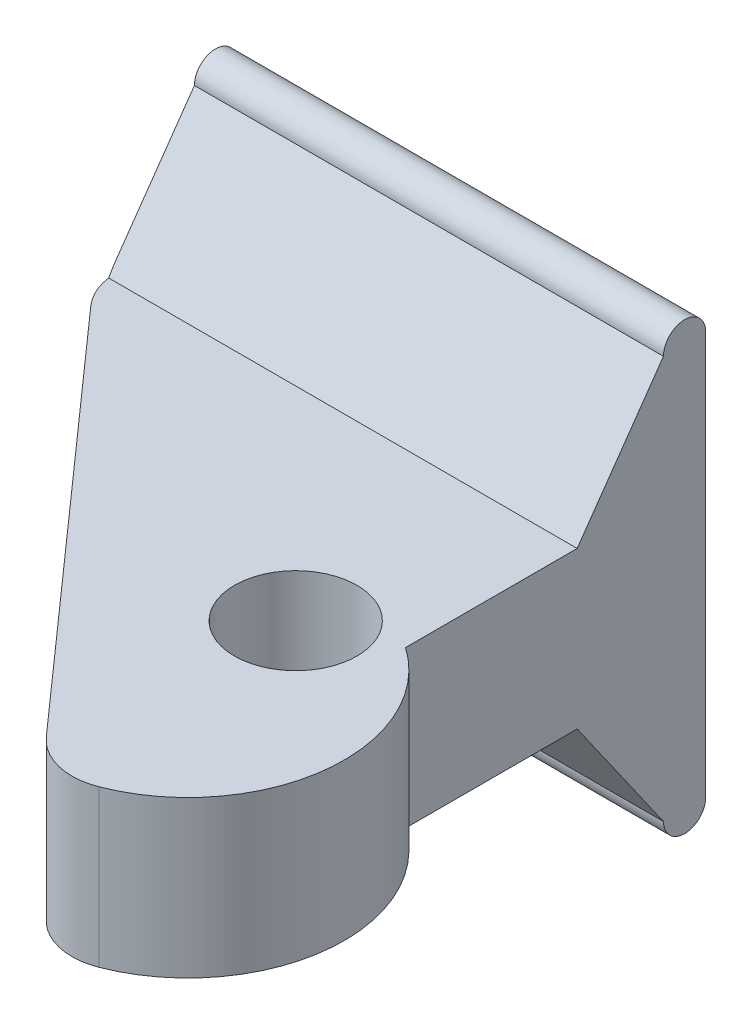
from build123d import *

# Parameters (mm, degrees)
SKETCH1_R               = 2.4892
BOSS_EXTRUDE1_DEPTH     = 6.35
BOSS_EXTRUDE2_START     = -6.35
BOSS_EXTRUDE2_DEPTH     = 19.05
BOSS_EXTRUDE2_START_2   = -6.555460136
BOSS_EXTRUDE2_2_DEPTH   = 19.460920272
BOSS_EXTRUDE2_START_3   = -10
BOSS_EXTRUDE2_3_DEPTH   = 3.65
CUT_EXTRUDE1_DEPTH      = 27.910448217
CUT_EXTRUDE1_DEPTH_BACK = 27.910448217
SKETCH3_W               = 2.179354936
SKETCH3_H               = 6.35
CUT_EXTRUDE2_DEPTH      = 31.98795935
CUT_EXTRUDE2_DEPTH_BACK = 31.98795935
BOSS_EXTRUDE4_START     = -6.35
SKETCH8_R               = 2.4892
BOSS_EXTRUDE4_DEPTH     = 6.35
CUT_EXTRUDE3_DEPTH      = 27.585891059
CUT_EXTRUDE3_DEPTH_BACK = 27.585891059
SKETCH7_R               = 2.4892
CUT_EXTRUDE4_DEPTH      = 27.585891059
CUT_EXTRUDE4_DEPTH_BACK = 27.585891059
FILLET1_R               = 2.54


with BuildPart() as part:
    # Sketch1 → Boss-Extrude1 (new body)
    with BuildSketch(Plane(origin=(0, 0, 0), x_dir=(1, 0, 0), z_dir=(0, 1, 0))):
        with BuildLine():
            Line((9.525, -17.889269346), (-0.578271622, -16.817120786))
            Line((-0.578271622, -16.817120786), (-6.35, 0))
            Line((-6.35, 0), (12.7, 0))
            Line((12.7, 0), (12.7, -6.35))
            ThreePointArc((12.7, -6.35), (15.186560179, -13.240601753), (9.525, -17.889269346))
        make_face()
        with Locations(Location((9.525, -11.43, 0), (0, 0, 270))):
            Circle(SKETCH1_R, mode=Mode.SUBTRACT)
    extrude(amount=BOSS_EXTRUDE1_DEPTH)

    # Boss-Extrude2: read off the stored shape, not the designer's step
    # Boss-Extrude2 outline → Boss-Extrude2 (add)
    with BuildSketch(Plane.YZ.offset(BOSS_EXTRUDE2_START)):
        with BuildLine():
            ThreePointArc((11.551615481, -6.35), (12.905510296, -4.996105185), (11.551615481, -3.642210371))
            Line((11.551615481, -3.642210371), (6.35, 0))
            Line((6.35, 0), (0, 0))
            Line((0, 0), (-5.201615481, -3.642210371))
            ThreePointArc((-5.201615481, -3.642210371), (-6.555510296, -4.996105185), (-5.201615481, -6.35))
            Line((-5.201615481, -6.35), (11.551615481, -6.35))
        make_face()
    extrude(amount=BOSS_EXTRUDE2_DEPTH)

    # Boss-Extrude2 2 outline → Boss-Extrude2 2 (add)
    with BuildSketch(Plane(origin=(0, 0, 0), x_dir=(1, 0, 0), z_dir=(0, 1, 0)).offset(BOSS_EXTRUDE2_START_2)):
        Polygon((-8.529354936, 6.35), (-6.35, 0), (-6.35, 6.35), align=None)
    extrude(amount=BOSS_EXTRUDE2_2_DEPTH)

    # Boss-Extrude2 3 outline → Boss-Extrude2 3 (cut)
    with BuildSketch(Plane.YZ.offset(BOSS_EXTRUDE2_START_3)):
        with BuildLine():
            Line((12.905460136, 0), (6.35, 0))
            Line((6.35, 0), (11.551615481, -3.642210371))
            ThreePointArc((11.551615481, -3.642210371), (12.504834401, -4.034645431), (12.905460136, -4.984450993))
            Line((12.905460136, -4.984450993), (12.905460136, 0))
        make_face()
        with BuildLine():
            ThreePointArc((12.905460136, -5.007759378), (12.504834401, -5.95756494), (11.551615481, -6.35))
            Line((11.551615481, -6.35), (12.905460136, -6.35))
            Line((12.905460136, -6.35), (12.905460136, -5.007759378))
        make_face()
        with BuildLine():
            Line((0, 0), (-6.555460136, 0))
            Line((-6.555460136, 0), (-6.555460136, -4.984450993))
            ThreePointArc((-6.555460136, -4.984450993), (-6.154834401, -4.034645431), (-5.201615481, -3.642210371))
            Line((-5.201615481, -3.642210371), (0, 0))
        make_face()
        with BuildLine():
            ThreePointArc((-5.201615481, -6.35), (-6.154834401, -5.95756494), (-6.555460136, -5.007759378))
            Line((-6.555460136, -5.007759378), (-6.555460136, -6.35))
            Line((-6.555460136, -6.35), (-5.201615481, -6.35))
        make_face()
    extrude(amount=BOSS_EXTRUDE2_3_DEPTH, mode=Mode.SUBTRACT)

    # Sketch3 → Cut-Extrude1 (cut, two sides: drawn at the far end of the back side and taken through both)
    with BuildSketch(Plane.XZ.offset(-CUT_EXTRUDE1_DEPTH_BACK)):
        with Locations((-7.439677468, -3.175)):
            Rectangle(SKETCH3_W, SKETCH3_H)
    extrude(amount=CUT_EXTRUDE1_DEPTH + CUT_EXTRUDE1_DEPTH_BACK, mode=Mode.SUBTRACT)

    # Sketch4 → Cut-Extrude2 (cut, two sides: drawn at the far end of the back side and taken through both)
    with BuildSketch(Plane.ZY.offset(6.35).offset(-CUT_EXTRUDE2_DEPTH_BACK)):
        with BuildLine():
            ThreePointArc((-5.842, -5.006022622), (-4.983704134, -5.864318488), (-4.125408268, -5.006022622))
            Line((-4.125408268, -5.006022622), (-0.620153491, 0))
            Line((-0.620153491, 0), (0, 0))
            Line((0, 0), (-3.642210371, -5.201615481))
            ThreePointArc((-3.642210371, -5.201615481), (-4.996105185, -6.555510296), (-6.35, -5.201615481))
            Line((-6.35, -5.201615481), (-6.35, 11.551615481))
            ThreePointArc((-6.35, 11.551615481), (-4.996105185, 12.905510296), (-3.642210371, 11.551615481))
            Line((-3.642210371, 11.551615481), (0, 6.35))
            Line((0, 6.35), (-0.620153491, 6.35))
            Line((-0.620153491, 6.35), (-4.125408268, 11.356022622))
            ThreePointArc((-4.125408268, 11.356022622), (-4.983704134, 12.214318488), (-5.842, 11.356022622))
            Line((-5.842, 11.356022622), (-5.842, -5.006022622))
        make_face()
    extrude(amount=CUT_EXTRUDE2_DEPTH + CUT_EXTRUDE2_DEPTH_BACK, mode=Mode.SUBTRACT)

    # Sketch8 → Boss-Extrude4 (add)
    with BuildSketch(Plane(origin=(0, 6.35, 0), x_dir=(1, 0, 0), z_dir=(0, 1, 0)).offset(BOSS_EXTRUDE4_START)):
        with Locations((9.525, -11.43)):
            Circle(SKETCH8_R)
    extrude(amount=BOSS_EXTRUDE4_DEPTH)

    # Sketch7 → Cut-Extrude3 (cut, two sides: drawn at the far end of the back side and taken through both)
    with BuildSketch(Plane(origin=(0, 6.35, 0), x_dir=(1, 0, 0), z_dir=(0, 1, 0)).offset(-CUT_EXTRUDE3_DEPTH_BACK)):
        with Locations(Location((9.525, -7.634846509, 0), (0, 0, 270))):
            Circle(SKETCH7_R)
    extrude(amount=CUT_EXTRUDE3_DEPTH + CUT_EXTRUDE3_DEPTH_BACK, mode=Mode.SUBTRACT)

    # Sketch9 → Cut-Extrude4 (cut, two sides: drawn at the far end of the back side and taken through both)
    with BuildSketch(Plane(origin=(0, 6.35, 0), x_dir=(1, 0, 0), z_dir=(0, 1, 0)).offset(-CUT_EXTRUDE4_DEPTH_BACK)):
        Polygon((9.525, -17.889269346), (-6.35, 0), (-0.578271622, -16.817120786), align=None)
    extrude(amount=CUT_EXTRUDE4_DEPTH + CUT_EXTRUDE4_DEPTH_BACK, mode=Mode.SUBTRACT)

    # Fillet1
    fillet1_edges = [part.edges().sort_by_distance(p)[0] for p in [
        (9.525, 3.175, 17.889269346),
        (-6.35, 3.175, 0),
    ]]
    fillet(fillet1_edges, radius=FILLET1_R)


solid = part.part
